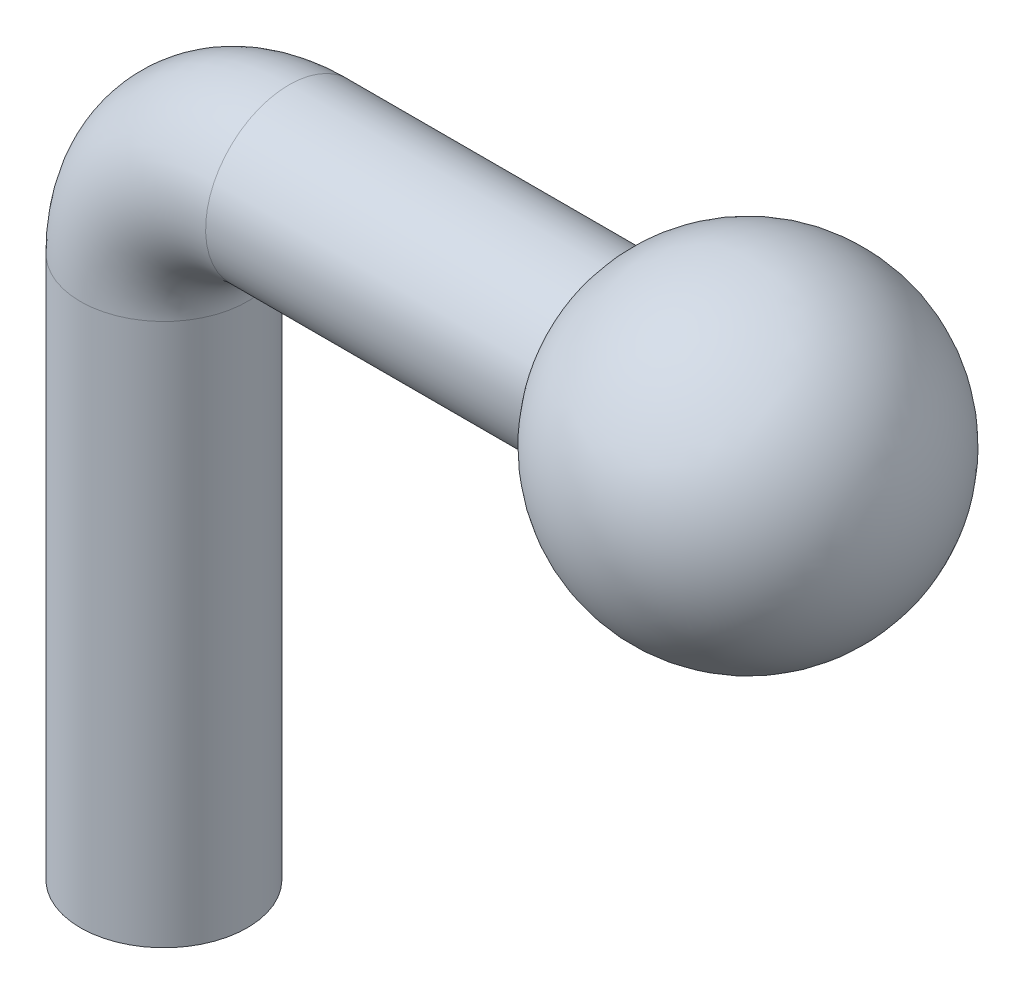
from build123d import *

# Parameters (mm, degrees)
SKETCH1_R = 2


with BuildPart() as part:
    # Sweep1: sweep along a path in Sketch3
    with BuildLine(Plane.XY) as sweep1_path:
        Line((0, 0), (0, 13))
        ThreePointArc((0, 13), (0.878679656, 15.121320344), (3, 16))
        Line((3, 16), (14, 16))
    # Sketch1 → Sweep1 (sweep)
    with BuildSketch(Plane(origin=(0, 0, 0), x_dir=(1, 0, 0), z_dir=(0, 1, 0))):
        Circle(SKETCH1_R)
    sweep(path=sweep1_path.line)

    # Sketch4 → Revolve1 (revolve)
    with BuildSketch(Plane.XY):
        with BuildLine():
            ThreePointArc((17.9, 16), (14, 19.9), (10.1, 16))
            Line((10.1, 16), (17.9, 16))
        make_face()
    revolve(axis=Axis((10.1, 16, 0), (1, 0, 0)))


solid = part.part
